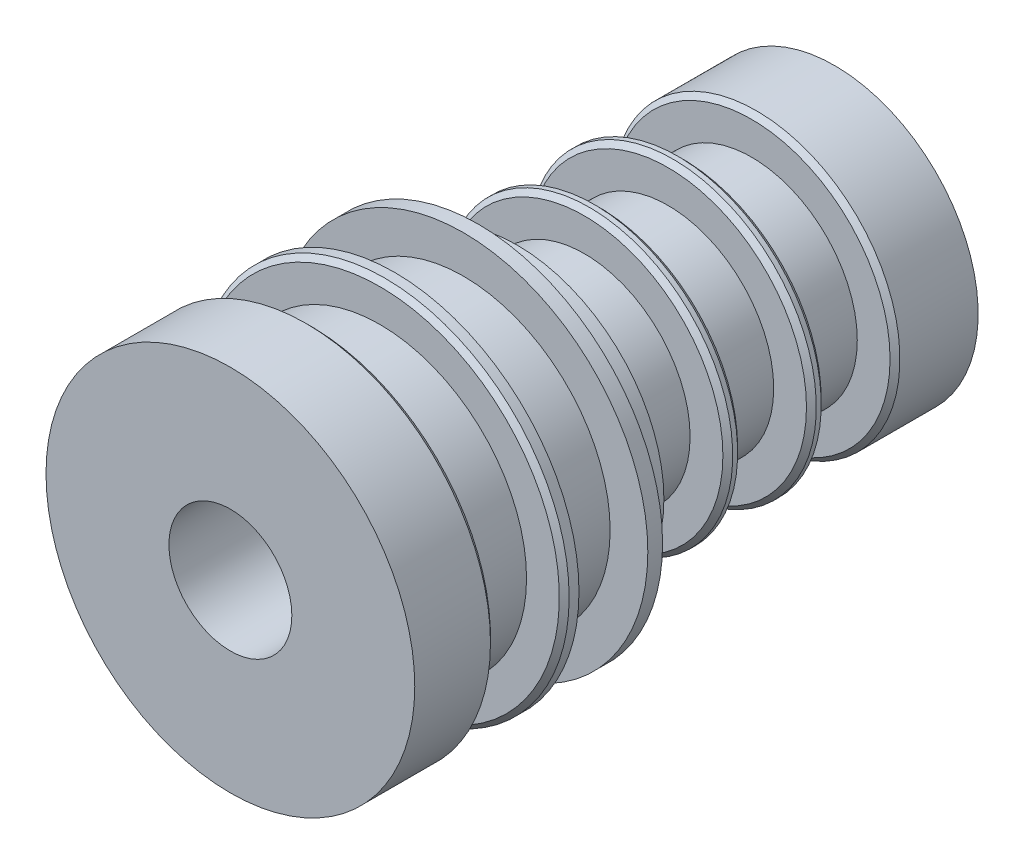
from build123d import *

# Parameters (mm, degrees)
SKETCH1_R           = 11.1125
SKETCH1_R_2         = 3.2004
EXTRUDE1_DEPTH      = 25.003125
BOSS_EXTRUDE1_START = -25.4
SKETCH8_R           = 14.2875
SKETCH8_R_2         = 3.2004
BOSS_EXTRUDE1_DEPTH = 25.4
CUT_EXTRUDE1_START  = -3.175
SKETCH5_R           = 14.2875
SKETCH5_R_2         = 3.2004
CUT_EXTRUDE1_DEPTH  = 3.175
SKETCH6_R           = 4.7625
CUT_EXTRUDE2_DEPTH  = 52.004228149
CUT_EXTRUDE3_START  = -11.77925
SKETCH7_R           = 11.1125
SKETCH7_R_2         = 8.1915
CUT_EXTRUDE3_DEPTH  = 5.334
CHAMFER2_SIZE       = 0.381
CUT_EXTRUDE4_START  = 8.9154
SKETCH9_R           = 14.2875
SKETCH9_R_2         = 11.3665
CUT_EXTRUDE4_DEPTH  = 2.667
CHAMFER3_SIZE       = 0.381
LPATTERN2_COUNT     = 3
LPATTERN2_PITCH     = 6.477


# Read off the part's stored shape, not the designer's step: LPattern1
with BuildPart() as part:
    # Sketch1 → Extrude1 (new, symmetric)
    with BuildSketch(Plane.XY):
        with Locations(Location((0, 0, 0), (0, 0, 180))):
            Circle(SKETCH1_R)
        with Locations(Location((0, 0, 0), (0, 0, 180))):
            Circle(SKETCH1_R_2, mode=Mode.SUBTRACT)
    extrude(amount=EXTRUDE1_DEPTH, both=True)

    # Sketch8 → Boss-Extrude1 (add)
    with BuildSketch(Plane.XY.offset(25.003125).offset(BOSS_EXTRUDE1_START)):
        Circle(SKETCH8_R)
        with Locations(Location((0, 0, 0), (0, 0, 180))):
            Circle(SKETCH8_R_2, mode=Mode.SUBTRACT)
    extrude(amount=BOSS_EXTRUDE1_DEPTH)

    # Sketch5 → Cut-Extrude1 (cut)
    with BuildSketch(Plane.XY.offset(25.003125).offset(CUT_EXTRUDE1_START)):
        Circle(SKETCH5_R)
        with Locations(Location((0, 0, 0), (0, 0, 180))):
            Circle(SKETCH5_R_2, mode=Mode.SUBTRACT)
    extrude(amount=CUT_EXTRUDE1_DEPTH, mode=Mode.SUBTRACT)

    # Sketch6 → Cut-Extrude2 (cut, through all)
    with BuildSketch(Plane.XY.offset(21.828125)):
        Circle(SKETCH6_R)
    extrude(amount=-CUT_EXTRUDE2_DEPTH, mode=Mode.SUBTRACT)

    # Sketch7 → Cut-Extrude3 (cut)
    with BuildSketch(Plane(origin=(0, 0, -25.003125), x_dir=(-1, 0, 0), z_dir=(0, 0, -1)).offset(CUT_EXTRUDE3_START)):
        Circle(SKETCH7_R)
        Circle(SKETCH7_R_2, mode=Mode.SUBTRACT)
    extrude(amount=CUT_EXTRUDE3_DEPTH, mode=Mode.SUBTRACT)

    # Chamfer2
    chamfer2_edges = [part.edges().sort_by_distance(p)[0] for p in [
        (11.1125, 0, -13.223875),
        (11.1125, 0, -18.557875),
    ]]
    chamfer(chamfer2_edges, length=CHAMFER2_SIZE)

    # Sketch9 → Cut-Extrude4 (cut, symmetric)
    with BuildSketch(Plane(origin=(0, 0, 21.828125), x_dir=(-1, 0, 0), z_dir=(0, 0, -1)).offset(CUT_EXTRUDE4_START)):
        with Locations(Location((0, 0, 0), (0, 0, 180))):
            Circle(SKETCH9_R)
        Circle(SKETCH9_R_2, mode=Mode.SUBTRACT)
    cut_extrude4 = extrude(amount=CUT_EXTRUDE4_DEPTH, both=True, mode=Mode.SUBTRACT)

    # Chamfer3
    chamfer3_edges = [part.edges().sort_by_distance(p)[0] for p in [
        (-14.2875, 0, 15.579725),
        (-14.2875, 0, 10.245725),
    ]]
    chamfer(chamfer3_edges, length=CHAMFER3_SIZE)

    # LPattern1 outline → LPattern1 (revolve, cut)
    with BuildSketch(Plane.XZ):
        Polygon((11.1125, -0.269875), (8.1915, -0.269875), (8.1915, -5.603875), (10.7315, -5.603875), (11.1125, -5.984875), align=None)
        Polygon((11.1125, -12.461875), (11.1125, -6.365875), (10.7315, -6.746875), (8.1915, -6.746875), (8.1915, -12.080875), (10.7315, -12.080875), align=None)
    revolve(axis=Axis((0, 0, 0), (0, 0, 1)), mode=Mode.SUBTRACT)

    # LPattern2: Cut-Extrude4 ×3
    with Locations(*[(0, 0, -i * LPATTERN2_PITCH) for i in range(1, LPATTERN2_COUNT)]):
        add(cut_extrude4, mode=Mode.SUBTRACT)


solid = part.part
